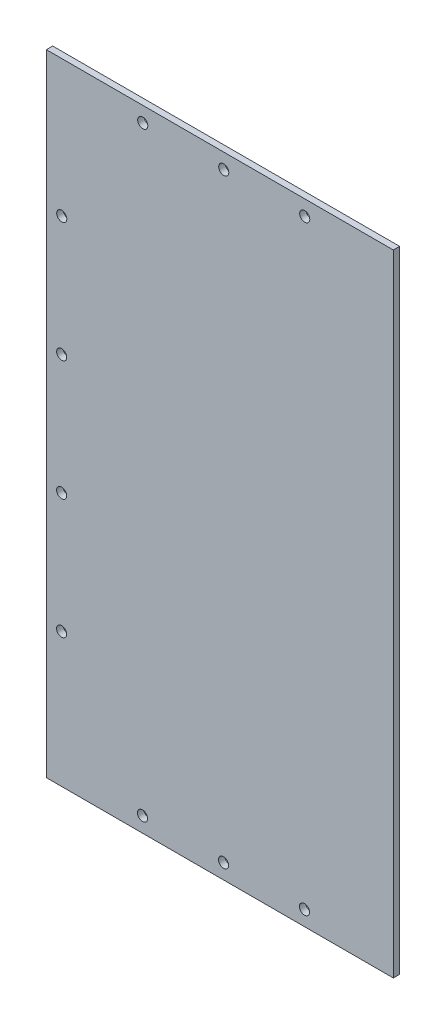
from build123d import *

# Parameters (mm, degrees)
BASE_FLANGE1_OUTLINE_W = 274.2634
BASE_FLANGE1_OUTLINE_H = 498.347194877
BASE_FLANGE1_DEPTH     = 5
CUT_EXTRUDE1_REACH     = 502.286
SKETCH6_R              = 4


# Read off the part's stored shape, not the designer's step: Base-Flange1
with BuildPart() as part:
    # Base-Flange1 outline → Base-Flange1 (new body)
    with BuildSketch(Plane.XY):
        with Locations((-91.710148042, -195.677360812)):
            Rectangle(BASE_FLANGE1_OUTLINE_W, BASE_FLANGE1_OUTLINE_H)
    extrude(amount=BASE_FLANGE1_DEPTH)

    # Sketch6 → Cut-Extrude1 (cut, up to next)
    with BuildSketch(Plane(origin=(0, 0, 0), x_dir=(-1, 0, 0), z_dir=(0, 0, -1)), mode=Mode.PRIVATE) as cut_extrude1_sk1:
        with Locations((152.63724292, 41.471236627)):
            Circle(SKETCH6_R)
    cut_extrude1_tool1 = extrude(cut_extrude1_sk1.sketch, amount=-CUT_EXTRUDE1_REACH, mode=Mode.PRIVATE) & part.part
    # Sketch6 → Cut-Extrude1 (cut, up to next)
    with BuildSketch(Plane(origin=(0, 0, 0), x_dir=(-1, 0, 0), z_dir=(0, 0, -1)), mode=Mode.PRIVATE) as cut_extrude1_sk2:
        with Locations((88.62924292, 41.471236627)):
            Circle(SKETCH6_R)
    cut_extrude1_tool2 = extrude(cut_extrude1_sk2.sketch, amount=-CUT_EXTRUDE1_REACH, mode=Mode.PRIVATE) & part.part
    # Sketch6 → Cut-Extrude1 (cut, up to next)
    with BuildSketch(Plane(origin=(0, 0, 0), x_dir=(-1, 0, 0), z_dir=(0, 0, -1)), mode=Mode.PRIVATE) as cut_extrude1_sk3:
        with Locations((24.62124292, 41.471236627)):
            Circle(SKETCH6_R)
    cut_extrude1_tool3 = extrude(cut_extrude1_sk3.sketch, amount=-CUT_EXTRUDE1_REACH, mode=Mode.PRIVATE) & part.part
    # Sketch6 → Cut-Extrude1 (cut, up to next)
    with BuildSketch(Plane(origin=(0, 0, 0), x_dir=(-1, 0, 0), z_dir=(0, 0, -1)), mode=Mode.PRIVATE) as cut_extrude1_sk4:
        with Locations((216.673520112, -54.328763373)):
            Circle(SKETCH6_R)
    cut_extrude1_tool4 = extrude(cut_extrude1_sk4.sketch, amount=-CUT_EXTRUDE1_REACH, mode=Mode.PRIVATE) & part.part
    # Sketch6 → Cut-Extrude1 (cut, up to next)
    with BuildSketch(Plane(origin=(0, 0, 0), x_dir=(-1, 0, 0), z_dir=(0, 0, -1)), mode=Mode.PRIVATE) as cut_extrude1_sk5:
        with Locations((216.709396665, -149.070763373)):
            Circle(SKETCH6_R)
    cut_extrude1_tool5 = extrude(cut_extrude1_sk5.sketch, amount=-CUT_EXTRUDE1_REACH, mode=Mode.PRIVATE) & part.part
    # Sketch6 → Cut-Extrude1 (cut, up to next)
    with BuildSketch(Plane(origin=(0, 0, 0), x_dir=(-1, 0, 0), z_dir=(0, 0, -1)), mode=Mode.PRIVATE) as cut_extrude1_sk6:
        with Locations((216.745295182, -243.870763373)):
            Circle(SKETCH6_R)
    cut_extrude1_tool6 = extrude(cut_extrude1_sk6.sketch, amount=-CUT_EXTRUDE1_REACH, mode=Mode.PRIVATE) & part.part
    # Sketch6 → Cut-Extrude1 (cut, up to next)
    with BuildSketch(Plane(origin=(0, 0, 0), x_dir=(-1, 0, 0), z_dir=(0, 0, -1)), mode=Mode.PRIVATE) as cut_extrude1_sk7:
        with Locations((216.781193698, -338.670763373)):
            Circle(SKETCH6_R)
    cut_extrude1_tool7 = extrude(cut_extrude1_sk7.sketch, amount=-CUT_EXTRUDE1_REACH, mode=Mode.PRIVATE) & part.part
    # Sketch6 → Cut-Extrude1 (cut, up to next)
    with BuildSketch(Plane(origin=(0, 0, 0), x_dir=(-1, 0, 0), z_dir=(0, 0, -1)), mode=Mode.PRIVATE) as cut_extrude1_sk8:
        with Locations((152.808848042, -432.870680177)):
            Circle(SKETCH6_R)
    cut_extrude1_tool8 = extrude(cut_extrude1_sk8.sketch, amount=-CUT_EXTRUDE1_REACH, mode=Mode.PRIVATE) & part.part
    # Sketch6 → Cut-Extrude1 (cut, up to next)
    with BuildSketch(Plane(origin=(0, 0, 0), x_dir=(-1, 0, 0), z_dir=(0, 0, -1)), mode=Mode.PRIVATE) as cut_extrude1_sk9:
        with Locations((88.800848042, -432.915402104)):
            Circle(SKETCH6_R)
    cut_extrude1_tool9 = extrude(cut_extrude1_sk9.sketch, amount=-CUT_EXTRUDE1_REACH, mode=Mode.PRIVATE) & part.part
    # Sketch6 → Cut-Extrude1 (cut, up to next)
    with BuildSketch(Plane(origin=(0, 0, 0), x_dir=(-1, 0, 0), z_dir=(0, 0, -1)), mode=Mode.PRIVATE) as cut_extrude1_sk10:
        with Locations((24.792848042, -432.960124031)):
            Circle(SKETCH6_R)
    cut_extrude1_tool10 = extrude(cut_extrude1_sk10.sketch, amount=-CUT_EXTRUDE1_REACH, mode=Mode.PRIVATE) & part.part
    add(cut_extrude1_tool1.solids().sort_by_distance((-152.637243, 41.471237, 0))[0], mode=Mode.SUBTRACT)
    add(cut_extrude1_tool2.solids().sort_by_distance((-88.629243, 41.471237, 0))[0], mode=Mode.SUBTRACT)
    add(cut_extrude1_tool3.solids().sort_by_distance((-24.621243, 41.471237, 0))[0], mode=Mode.SUBTRACT)
    add(cut_extrude1_tool4.solids().sort_by_distance((-216.67352, -54.328763, 0))[0], mode=Mode.SUBTRACT)
    add(cut_extrude1_tool5.solids().sort_by_distance((-216.709397, -149.070763, 0))[0], mode=Mode.SUBTRACT)
    add(cut_extrude1_tool6.solids().sort_by_distance((-216.745295, -243.870763, 0))[0], mode=Mode.SUBTRACT)
    add(cut_extrude1_tool7.solids().sort_by_distance((-216.781194, -338.670763, 0))[0], mode=Mode.SUBTRACT)
    add(cut_extrude1_tool8.solids().sort_by_distance((-152.808848, -432.87068, 0))[0], mode=Mode.SUBTRACT)
    add(cut_extrude1_tool9.solids().sort_by_distance((-88.800848, -432.915402, 0))[0], mode=Mode.SUBTRACT)
    add(cut_extrude1_tool10.solids().sort_by_distance((-24.792848, -432.960124, 0))[0], mode=Mode.SUBTRACT)


solid = part.part
